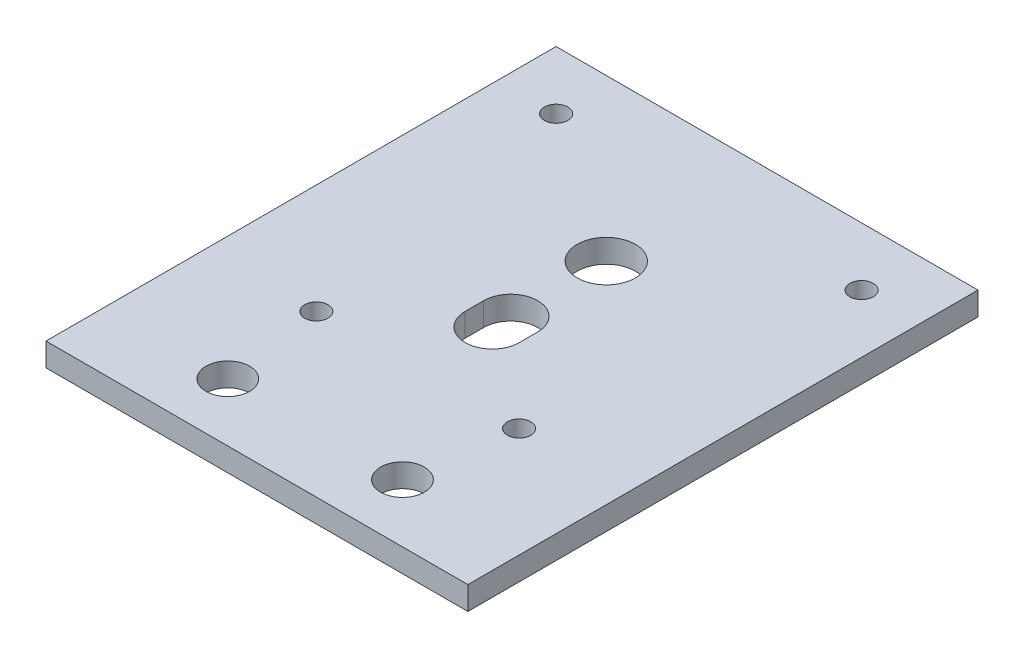
from build123d import *

# Parameters (mm, degrees)
BOSS_EXTRUDE1_DEPTH          = 5.08
F_3_8_0_375_DIAMETER_HOLE1_D = 9.525
F_3_8_0_375_DIAMETER_HOLE2_D = 9.525
SKETCH8_R                    = 6.35
CUT_EXTRUDE1_DEPTH           = 1371.578062618
SKETCH9_R                    = 2.5527
CUT_EXTRUDE2_DEPTH           = 1371.578062618
SKETCH10_OUTSIDE_W           = 496.242
SKETCH10_OUTSIDE_H           = 717.956
SKETCH10_OUTSIDE_W_2         = 92.023830603
SKETCH10_OUTSIDE_H_2         = 111.269815094
CUT_EXTRUDE3_DEPTH           = 1371.578062618


with BuildPart() as part:
    # Sketch1 → Boss-Extrude1 (new body)
    with BuildSketch(Plane(origin=(0, 0, 0), x_dir=(1, 0, 0), z_dir=(0, 1, 0))):
        with BuildLine():
            Line((186.706216966, -778.102360844), (-171.269771153, -778.102360844))
            add(Edge.make_bspline(
                [(-171.269771153, -778.102360844), (-159.707774454, -836.134775395), (-146.81892484, -893.9188082), (-132.611103769, -951.360767835), (-118.403260068, -1008.802818957), (-102.873342202, -1065.933903144), (-86.045569786, -1122.663773012), (-74.990089761, -1159.934062127), (-63.371281317, -1197.041907081), (-51.194215445, -1233.960969312), (-45.100567198, -1252.436009294), (-38.866841431, -1270.865430421), (-32.494599583, -1289.246240662), (-26.120797202, -1307.631552278), (-20.652525047, -1326.386680917), (-12.917829919, -1344.242199148)],
                knots=[0, 0, 0, 0, 0.177518923, 0.177518923, 0.177518923, 0.355038121, 0.355038121, 0.355038121, 0.471646972, 0.471646972, 0.471646972, 0.529995372, 0.529995372, 0.529995372, 0.588358391, 0.588358391, 0.588358391, 0.588358391], degree=3))
            ThreePointArc((-12.917829919, -1344.242199148), (7.718222897, -1357.79203399), (28.354275723, -1344.242199164))
            add(Edge.make_bspline(
                [(28.354275723, -1344.242199164), (38.120725658, -1321.696381858), (44.939237661, -1298.079369173), (60.823654171, -1251.671639351), (68.544496879, -1228.393431097), (91.029194373, -1158.368706478), (105.122355407, -1111.420274649), (144.723795491, -969.782644477), (167.537266257, -874.315888923), (186.706216966, -778.102360844)],
                knots=[0, 0, 0, 0, 0.125, 0.125, 0.25, 0.25, 0.5, 0.5, 1, 1, 1, 1], degree=3))
        make_face()
    extrude(amount=BOSS_EXTRUDE1_DEPTH)

    # 3/8 (0.375) Diameter Hole1 (through all)
    with Locations(Plane(origin=(0, 5.08, 0), x_dir=(1, 0, 0), z_dir=(0, 1, 0))):
        with Locations((7.718222897, -1326.04203399), (7.718222897, -1300.64203399)):
            Hole(F_3_8_0_375_DIAMETER_HOLE1_D / 2)

    # 3/8 (0.375) Diameter Hole2 (through all)
    with Locations(Plane(origin=(0, 5.08, 0), x_dir=(1, 0, 0), z_dir=(0, 1, 0))):
        with Locations((-49.431777094, -970.44203399), (-49.431777094, -1008.54203399), (64.868222906, -970.44203399), (64.868222906, -1008.54203399), (-11.331777094, -1205.39203399), (26.768222906, -1205.39203399)):
            Hole(F_3_8_0_375_DIAMETER_HOLE2_D / 2)

    # Sketch8 → Cut-Extrude1 (cut, through all)
    with BuildSketch(Plane(origin=(0, 5.08, 0), x_dir=(1, 0, 0), z_dir=(0, 1, 0))):
        with Locations((7.718222906, -1141.89203399)):
            Circle(SKETCH8_R)
        with BuildLine():
            Line((1.812722906, -1166.764753462), (1.812722906, -1162.739314519))
            ThreePointArc((1.812722906, -1162.739314519), (7.718222906, -1156.833814519), (13.623722906, -1162.739314519))
            Line((13.623722906, -1162.739314519), (13.623722906, -1166.764753462))
            ThreePointArc((13.623722906, -1166.764753462), (7.718222906, -1172.670253462), (1.812722906, -1166.764753462))
        make_face()
    extrude(amount=-CUT_EXTRUDE1_DEPTH, mode=Mode.SUBTRACT)

    # Sketch9 → Cut-Extrude2 (cut, through all)
    with BuildSketch(Plane(origin=(0, 5.08, 0), x_dir=(1, 0, 0), z_dir=(0, 1, 0))):
        with Locations((-14.396929121, -1183.022218896)):
            Circle(SKETCH9_R)
        with Locations((29.833374932, -1183.022218896)):
            Circle(SKETCH9_R)
        with Locations((41.030138207, -1119.522218896)):
            Circle(SKETCH9_R)
        with Locations((-25.593692396, -1119.522218896)):
            Circle(SKETCH9_R)
    extrude(amount=-CUT_EXTRUDE2_DEPTH, mode=Mode.SUBTRACT)

    # Sketch10 outside → Cut-Extrude3 (cut, through all)
    with BuildSketch(Plane(origin=(0, 5.08, 0), x_dir=(1, 0, 0), z_dir=(0, 1, 0))):
        with Locations((7.718, -1067.947)):
            Rectangle(SKETCH10_OUTSIDE_W, SKETCH10_OUTSIDE_H)
        with Locations((7.718222905, -1162.457126443)):
            Rectangle(SKETCH10_OUTSIDE_W_2, SKETCH10_OUTSIDE_H_2, mode=Mode.SUBTRACT)
    extrude(amount=-CUT_EXTRUDE3_DEPTH, mode=Mode.SUBTRACT)


solid = part.part
